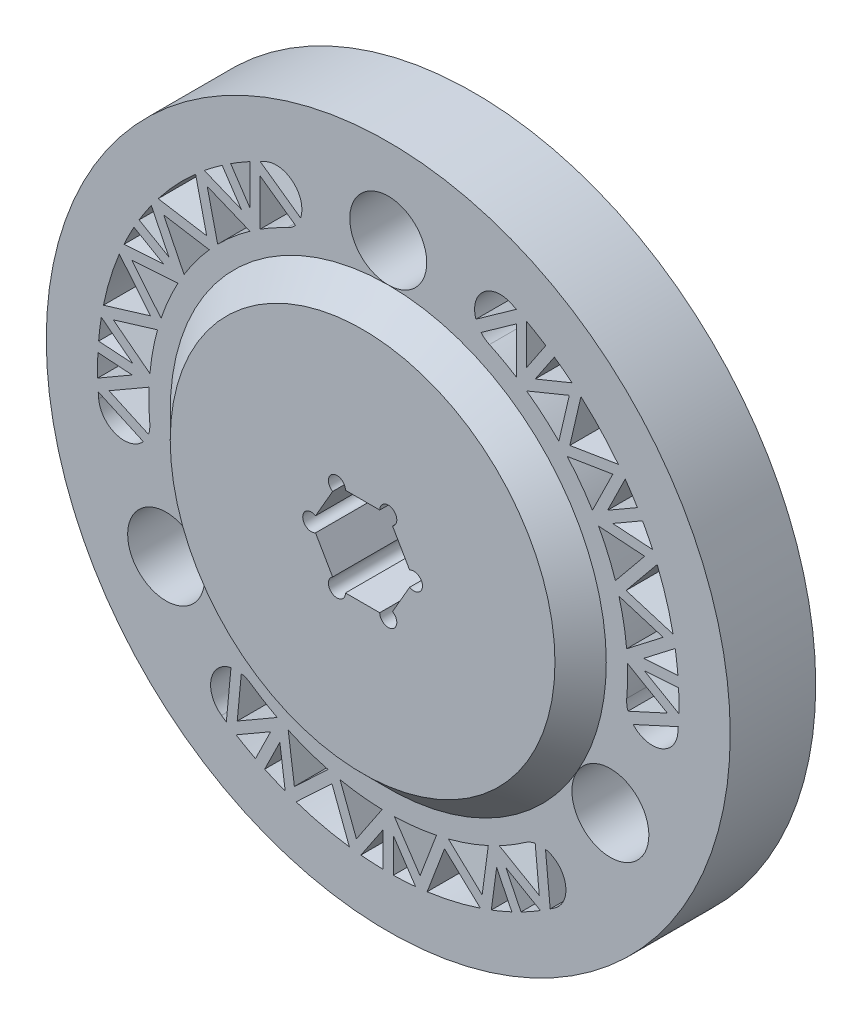
from build123d import *

# Parameters (mm, degrees)
SKETCH1_R           = 50.8
SKETCH1_R_2         = 5.715
BOSS_EXTRUDE1_DEPTH = 12.7
SKETCH2_R           = 32.385
BOSS_EXTRUDE2_DEPTH = 3.81
BOSS_EXTRUDE2_TAPER = 45
CUT_EXTRUDE1_DEPTH  = 73.955945611
EXTRUDE_THIN4_START = -12.7
EXTRUDE_THIN4_DEPTH = 12.7
CIRPATTERN1_COUNT   = 3
CUT_EXTRUDE2_DEPTH  = 74.714721054


# Read off the part's stored shape, not the designer's step: Extrude-Thin4
with BuildPart() as part:
    # Sketch1 → Boss-Extrude1 (new body)
    with BuildSketch(Plane.XY):
        Circle(SKETCH1_R)
        with Locations((-32.995567884, -19.05)):
            Circle(SKETCH1_R_2, mode=Mode.SUBTRACT)
        with BuildLine():
            Line((4.447821178, 5.504147737), (6.990642355, 1.099852263))
            ThreePointArc((6.990642355, 1.099852263), (8.260642355, 1.099852263), (8.895642355, 0))
            ThreePointArc((8.895642355, 0), (8.260642355, -1.099852263), (6.990642355, -1.099852263))
            Line((6.990642355, -1.099852263), (4.447821178, -5.504147737))
            ThreePointArc((4.447821178, -5.504147737), (4.912673441, -5.969), (5.082821178, -6.604))
            ThreePointArc((5.082821178, -6.604), (3.812821178, -7.874), (2.542821178, -6.604))
            Line((2.542821178, -6.604), (-2.542821178, -6.604))
            ThreePointArc((-2.542821178, -6.604), (-4.447821178, -7.703852263), (-4.447821178, -5.504147737))
            Line((-4.447821178, -5.504147737), (-6.990642355, -1.099852263))
            ThreePointArc((-6.990642355, -1.099852263), (-8.895642355, 0), (-6.990642355, 1.099852263))
            Line((-6.990642355, 1.099852263), (-4.447821178, 5.504147737))
            ThreePointArc((-4.447821178, 5.504147737), (-4.447821178, 7.703852263), (-2.542821178, 6.604))
            Line((-2.542821178, 6.604), (2.542821178, 6.604))
            ThreePointArc((2.542821178, 6.604), (3.812821178, 7.874), (5.082821178, 6.604))
            ThreePointArc((5.082821178, 6.604), (4.912673441, 5.969), (4.447821178, 5.504147737))
        make_face(mode=Mode.SUBTRACT)
        with Locations((32.995567884, -19.05)):
            Circle(SKETCH1_R_2, mode=Mode.SUBTRACT)
        with Locations((0, 38.1)):
            Circle(SKETCH1_R_2, mode=Mode.SUBTRACT)
    extrude(amount=BOSS_EXTRUDE1_DEPTH)

    # Sketch2 → Boss-Extrude2 (add)
    with BuildSketch(Plane.XY.offset(12.7)):
        Circle(SKETCH2_R)
    extrude(amount=BOSS_EXTRUDE2_DEPTH, taper=BOSS_EXTRUDE2_TAPER)

    # Sketch3 → Cut-Extrude1 (cut, through all)
    with BuildSketch(Plane.XY.offset(12.7)):
        with BuildLine():
            ThreePointArc((43.015687064, -3.763384972), (37.394976935, 21.59), (18.248656542, 39.134370244))
            ThreePointArc((18.248656542, 39.134370244), (13.185448296, 37.291513153), (15.028305387, 32.228304907))
            ThreePointArc((15.028305387, 32.228304907), (30.795863359, 17.78), (35.424683464, -3.099258212))
            ThreePointArc((35.424683464, -3.099258212), (38.888121884, -7.226823392), (43.015687064, -3.763384972))
        make_face()
        with BuildLine():
            ThreePointArc((-24.767030522, -35.370985272), (0, -43.18), (24.767030522, -35.370985272))
            ThreePointArc((24.767030522, -35.370985272), (25.702673588, -30.064689761), (20.396378077, -29.129046695))
            ThreePointArc((20.396378077, -29.129046695), (0, -35.56), (-20.396378077, -29.129046695))
            ThreePointArc((-20.396378077, -29.129046695), (-25.702673588, -30.064689761), (-24.767030522, -35.370985272))
        make_face()
        with BuildLine():
            ThreePointArc((-18.248656542, 39.134370244), (-37.394976935, 21.59), (-43.015687064, -3.763384972))
            ThreePointArc((-43.015687064, -3.763384972), (-38.888121884, -7.226823392), (-35.424683464, -3.099258212))
            ThreePointArc((-35.424683464, -3.099258212), (-30.795863359, 17.78), (-15.028305388, 32.228304907))
            ThreePointArc((-15.028305388, 32.228304907), (-13.185448296, 37.291513153), (-18.248656542, 39.134370244))
        make_face()
    extrude(amount=-CUT_EXTRUDE1_DEPTH, mode=Mode.SUBTRACT)

    # Extrude-Thin4 outline → Extrude-Thin4 (add)
    with BuildSketch(Plane.XY.offset(12.7).offset(EXTRUDE_THIN4_START)):
        with BuildLine():
            Line((-19.037305885, 30.034889456), (-19.037305885, 36.896328969))
            Line((-19.037305885, 36.896328969), (-13.782359909, 33.159696738))
            ThreePointArc((-13.782359909, 33.159696738), (-13.33390113, 33.785064358), (-13.020256245, 34.487792486))
            Line((-13.020256245, 34.487792486), (-19.02941669, 38.760723683))
            ThreePointArc((-19.02941669, 38.760723683), (-19.799305885, 38.373166229), (-20.561305885, 37.970318675))
            Line((-20.561305885, 37.970318675), (-20.561305885, 32.043508841))
            Line((-20.561305885, 32.043508841), (-23.405310516, 36.286413982))
            ThreePointArc((-23.405310516, 36.286413982), (-24.042014288, 35.867728516), (-24.671230346, 35.437872301))
            Line((-24.671230346, 35.437872301), (-21.827225715, 31.194967161))
            Line((-21.827225715, 31.194967161), (-27.309495926, 33.447030246))
            ThreePointArc((-27.309495926, 33.447030246), (-27.971671924, 32.895257557), (-28.622702381, 32.330377486))
            Line((-28.622702381, 32.330377486), (-26.971291732, 25.22436609))
            Line((-26.971291732, 25.22436609), (-34.171818956, 26.396954166))
            ThreePointArc((-34.171818956, 26.396954166), (-34.691905284, 25.709611193), (-35.198168341, 25.012024017))
            Line((-35.198168341, 25.012024017), (-32.58458563, 19.692601095))
            Line((-32.58458563, 19.692601095), (-37.008153735, 22.246549331))
            ThreePointArc((-37.008153735, 22.246549331), (-37.394976935, 21.59), (-37.770153734, 20.926726616))
            Line((-37.770153734, 20.926726616), (-33.34658563, 18.37277838))
            Line((-33.34658563, 18.37277838), (-39.260132369, 17.976495942))
            ThreePointArc((-39.260132369, 17.976495942), (-39.611129057, 17.189265685), (-39.946342368, 16.395186226))
            Line((-39.946342368, 16.395186226), (-35.330587695, 10.745640768))
            Line((-35.330587695, 10.745640768), (-42.310279408, 8.622798644))
            ThreePointArc((-42.310279408, 8.622798644), (-42.473964671, 7.776549693), (-42.620725837, 6.927202113))
            Line((-42.620725837, 6.927202113), (-37.929246889, 3.305448383))
            Line((-37.929246889, 3.305448383), (-43.025712842, 3.646976072))
            ThreePointArc((-43.025712842, 3.646976072), (-43.083371216, 2.887130874), (-43.127611579, 2.126386499))
            Line((-43.127611579, 2.126386499), (-38.031145625, 1.78485881))
            Line((-38.031145625, 1.78485881), (-43.163913505, -1.178546107))
            ThreePointArc((-43.163913505, -1.178546107), (-43.131789721, -2.039881242), (-43.082479724, -2.900403569))
            Line((-43.082479724, -2.900403569), (-36.377432536, -5.968023571))
            ThreePointArc((-36.377432536, -5.968023571), (-35.925674567, -5.345035069), (-35.608319711, -4.643974564))
            Line((-35.608319711, -4.643974564), (-41.471811136, -1.961373969))
            Line((-41.471811136, -1.961373969), (-35.529630211, 1.469345788))
            ThreePointArc((-35.529630211, 1.469345788), (-35.480423354, 2.37763719), (-35.40800044, 3.284372823))
            Line((-35.40800044, 3.284372823), (-40.839303271, 7.477259865))
            Line((-40.839303271, 7.477259865), (-34.274773539, 9.473832323))
            ThreePointArc((-34.274773539, 9.473832323), (-34.021239545, 10.347408365), (-33.745444288, 11.214213742))
            Line((-33.745444288, 11.214213742), (-38.086647314, 16.527716209))
            Line((-38.086647314, 16.527716209), (-31.240562424, 16.986490499))
            ThreePointArc((-31.240562424, 16.986490499), (-30.795863359, 17.78), (-30.331013505, 18.561875438))
            Line((-30.331013505, 18.561875438), (-33.35674576, 24.720146015))
            Line((-33.35674576, 24.720146015), (-26.584516128, 23.617305144))
            ThreePointArc((-26.584516128, 23.617305144), (-25.971738279, 24.289553532), (-25.341966232, 24.945908432))
            Line((-25.341966232, 24.945908432), (-26.895148629, 31.629244173))
            Line((-26.895148629, 31.629244173), (-20.54835052, 29.022041467))
            ThreePointArc((-20.54835052, 29.022041467), (-19.799305885, 29.538129367), (-19.037305885, 30.034889456))
        make_face()
    extrude_thin4 = extrude(amount=EXTRUDE_THIN4_DEPTH)

    # CirPattern1: Extrude-Thin4 ×3 about axis
    cirpattern1_axis = Axis((0, 0, 0), (0, 0, 1))
    for i in range(1, CIRPATTERN1_COUNT):
        add(extrude_thin4.rotate(cirpattern1_axis, i * 360 / CIRPATTERN1_COUNT))

    # Sketch7 → Cut-Extrude2 (cut, through all)
    with BuildSketch(Plane(origin=(0, 0, 0), x_dir=(-1, 0, 0), z_dir=(0, 0, -1))):
        with BuildLine():
            Line((6.990642355, 1.099852263), (4.447821178, 5.504147737))
            ThreePointArc((4.447821178, 5.504147737), (4.447821178, 7.703852263), (2.542821178, 6.604))
            Line((2.542821178, 6.604), (-2.542821178, 6.604))
            ThreePointArc((-2.542821178, 6.604), (-4.447821178, 7.703852263), (-4.447821178, 5.504147737))
            Line((-4.447821178, 5.504147737), (-6.990642355, 1.099852263))
            ThreePointArc((-6.990642355, 1.099852263), (-8.895642355, 0), (-6.990642355, -1.099852263))
            Line((-6.990642355, -1.099852263), (-4.447821178, -5.504147737))
            ThreePointArc((-4.447821178, -5.504147737), (-4.447821178, -7.703852263), (-2.542821178, -6.604))
            Line((-2.542821178, -6.604), (2.542821178, -6.604))
            ThreePointArc((2.542821178, -6.604), (4.447821178, -7.703852263), (4.447821178, -5.504147737))
            Line((4.447821178, -5.504147737), (6.990642355, -1.099852263))
            ThreePointArc((6.990642355, -1.099852263), (8.895642355, 0), (6.990642355, 1.099852263))
        make_face()
    extrude(amount=-CUT_EXTRUDE2_DEPTH, mode=Mode.SUBTRACT)


solid = part.part
